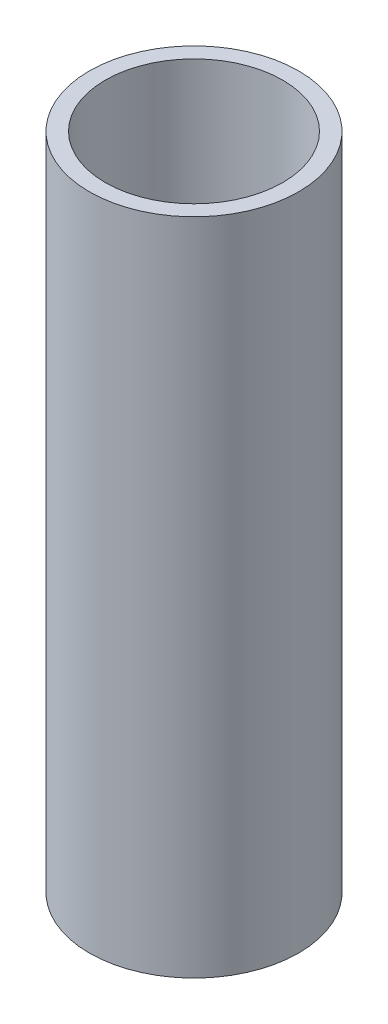
from build123d import *

# Parameters (mm, degrees)
SKETCH1_R           = 15.875
SKETCH1_R_2         = 13.462
BOSS_EXTRUDE1_DEPTH = 100


with BuildPart() as part:
    # Sketch1 → Boss-Extrude1 (new body)
    with BuildSketch(Plane(origin=(0, 0, 0), x_dir=(1, 0, 0), z_dir=(0, 1, 0))):
        Circle(SKETCH1_R)
        Circle(SKETCH1_R_2, mode=Mode.SUBTRACT)
    extrude(amount=BOSS_EXTRUDE1_DEPTH)


solid = part.part
